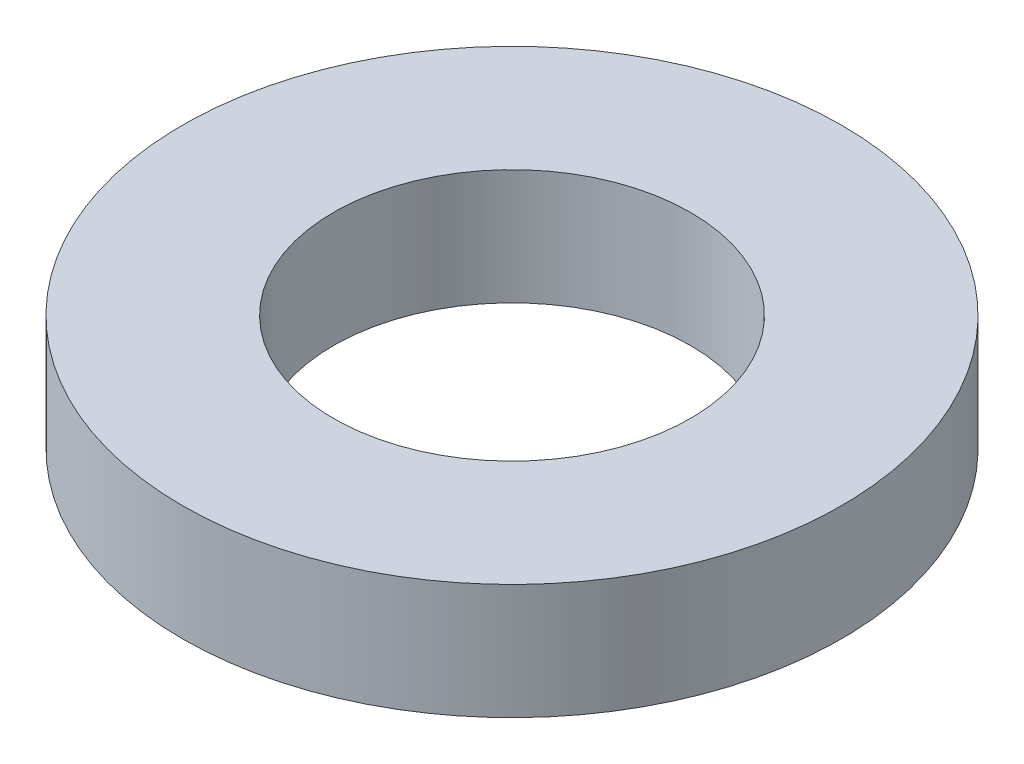
from build123d import *

# Parameters (mm, degrees)
SKETCH1_R           = 60
BOSS_EXTRUDE1_DEPTH = 21
SKETCH2_R           = 32.5
CUT_EXTRUDE1_DEPTH  = 88.412813706


with BuildPart() as part:
    # Sketch1 → Boss-Extrude1 (new body)
    with BuildSketch(Plane(origin=(0, 0, 0), x_dir=(1, 0, 0), z_dir=(0, 1, 0))):
        Circle(SKETCH1_R)
    extrude(amount=BOSS_EXTRUDE1_DEPTH)

    # Sketch2 → Cut-Extrude1 (cut, through all)
    with BuildSketch(Plane(origin=(0, 0, 0), x_dir=(1, 0, 0), z_dir=(0, 1, 0))):
        Circle(SKETCH2_R)
    extrude(amount=CUT_EXTRUDE1_DEPTH, mode=Mode.SUBTRACT)


solid = part.part
